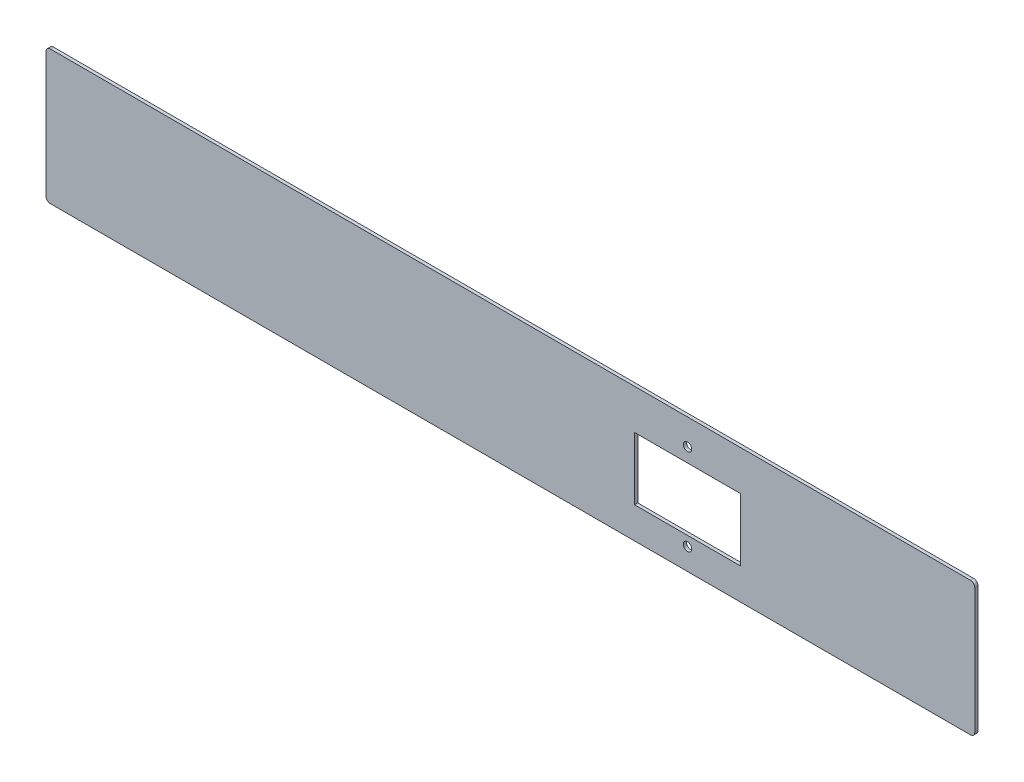
from build123d import *

# Parameters (mm, degrees)
SKETCH1_W           = 430
SKETCH1_H           = 62
SKETCH1_R           = 1.95
SKETCH1_W_2         = 49
SKETCH1_H_2         = 29
BOSS_EXTRUDE1_DEPTH = 1.5
FILLET1_R           = 2


with BuildPart() as part:
    # Sketch1 → Boss-Extrude1 (new body)
    with BuildSketch(Plane.XY):
        with Locations((-136.924811832, -1.296482412)):
            Rectangle(SKETCH1_W, SKETCH1_H)
        with Locations((-54.924811832, 17.703517588)):
            Circle(SKETCH1_R, mode=Mode.SUBTRACT)
        with Locations((-54.924811832, -22.296482412)):
            Circle(SKETCH1_R, mode=Mode.SUBTRACT)
        with Locations((-54.924811832, -3.296482412)):
            Rectangle(SKETCH1_W_2, SKETCH1_H_2, mode=Mode.SUBTRACT)
    extrude(amount=BOSS_EXTRUDE1_DEPTH)

    # Fillet1
    fillet1_edges = [part.edges().sort_by_distance(p)[0] for p in [
        (78.075188168, 29.703517588, 0.75),
        (78.075188168, -32.296482412, 0.75),
        (-351.924811832, -32.296482412, 0.75),
        (-351.924811832, 29.703517588, 0.75),
    ]]
    fillet(fillet1_edges, radius=FILLET1_R)


solid = part.part
